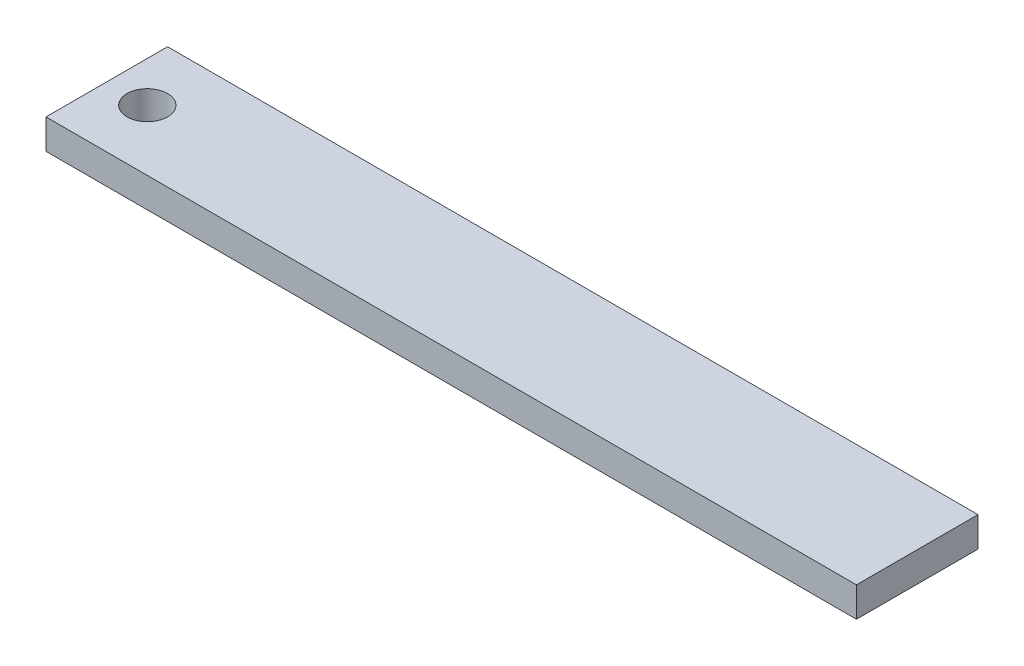
from build123d import *

# Parameters (mm, degrees)
SKETCH1_W          = 20
SKETCH1_H          = 3
SKETCH1_R          = 0.5
BASE_FLANGE1_DEPTH = 0.7366


# Sheet-metal steps are written as plain solids
with BuildPart() as part:
    # Sketch1 → Base-Flange1 (new body)
    with BuildSketch(Plane(origin=(0, 0, 0), x_dir=(1, 0, 0), z_dir=(0, 1, 0))):
        Rectangle(SKETCH1_W, SKETCH1_H)
        with Locations(Location((-9, 0, 0), (0, 0, 270))):
            Circle(SKETCH1_R, mode=Mode.SUBTRACT)
    extrude(amount=-BASE_FLANGE1_DEPTH)


solid = part.part
